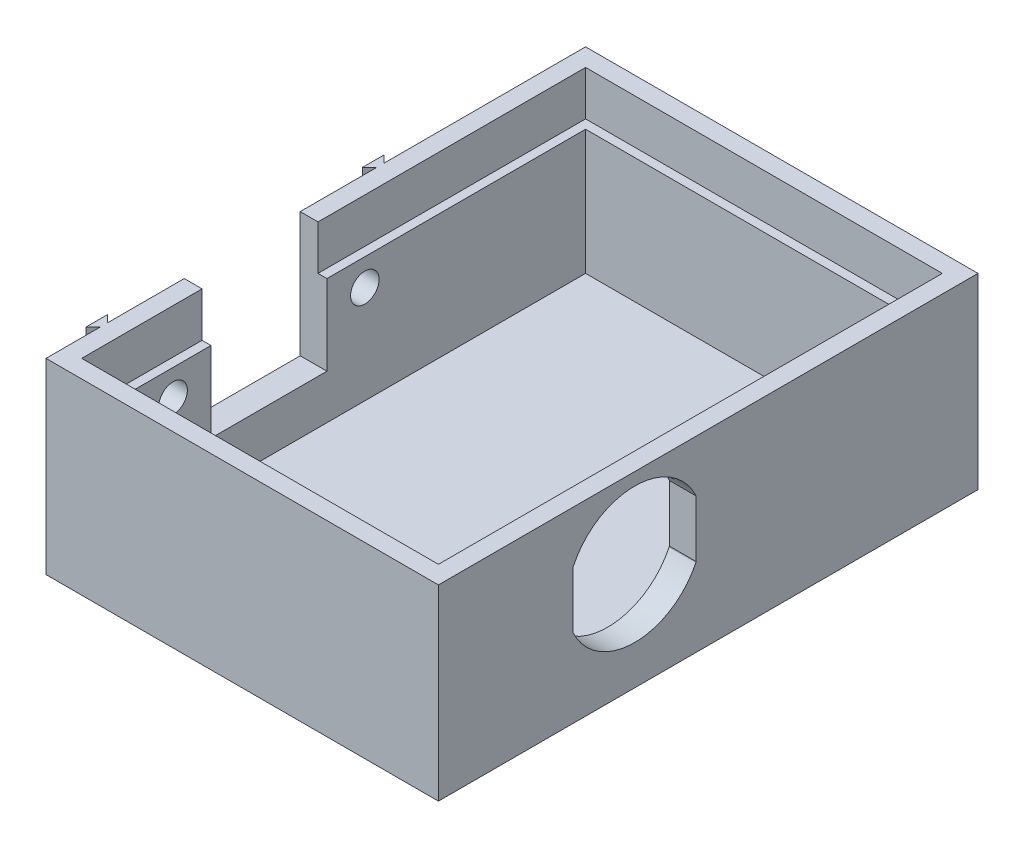
from build123d import *

# Parameters (mm, degrees)
CROQUIS3_W              = 44
CROQUIS3_H              = 60.5
SALIENTE_EXTRUIR1_DEPTH = 2
SALIENTE_EXTRUIR2_DEPTH = 19
CROQUIS5_W              = 3
CROQUIS5_H              = 13
SALIENTE_EXTRUIR3_DEPTH = 5
CROQUIS6_W              = 40
CROQUIS6_H              = 56.5
CROQUIS6_W_2            = 38
CROQUIS6_H_2            = 54.5
CORTAR_EXTRUIR1_DEPTH   = 5
SALIENTE_EXTRUIR4_DEPTH = 15
REDONDEO1_R             = 2
CORTAR_EXTRUIR4_DEPTH   = 10
CROQUIS9_R              = 1.6
CORTAR_EXTRUIR5_DEPTH   = 10


with BuildPart() as part:
    # Croquis3 → Saliente-Extruir1 (new body)
    with BuildSketch(Plane(origin=(0, 0, 0), x_dir=(1, 0, 0), z_dir=(0, 1, 0))):
        with Locations((0, 16.480436564)):
            Rectangle(CROQUIS3_W, CROQUIS3_H)
    extrude(amount=SALIENTE_EXTRUIR1_DEPTH)

    # Croquis4 → Saliente-Extruir2 (add)
    with BuildSketch(Plane(origin=(0, 2, 0), x_dir=(1, 0, 0), z_dir=(0, 1, 0))):
        Polygon((-22, -13.769563436), (22, -13.769563436), (22, 46.730436564), (-22, 46.730436564), (-22, 14.730436564), (-19, 14.730436564), (-19, 43.730436564), (19, 43.730436564), (19, -10.769563436), (-19, -10.769563436), (-19, 1.730436564), (-22, 1.730436564), align=None)
    extrude(amount=SALIENTE_EXTRUIR2_DEPTH)

    # Croquis5 → Saliente-Extruir3 (add)
    with BuildSketch(Plane(origin=(0, 2, 0), x_dir=(1, 0, 0), z_dir=(0, 1, 0))):
        with Locations((-20.5, 8.230436564)):
            Rectangle(CROQUIS5_W, CROQUIS5_H)
    extrude(amount=SALIENTE_EXTRUIR3_DEPTH)

    # Croquis6 → Cortar-Extruir1 (cut)
    with BuildSketch(Plane(origin=(0, 21, 0), x_dir=(1, 0, 0), z_dir=(0, 1, 0))):
        with Locations((0, 16.480436564)):
            Rectangle(CROQUIS6_W, CROQUIS6_H)
        with Locations((0, 16.480436564)):
            Rectangle(CROQUIS6_W_2, CROQUIS6_H_2, mode=Mode.SUBTRACT)
    extrude(amount=-CORTAR_EXTRUIR1_DEPTH, mode=Mode.SUBTRACT)

    # Croquis7 → Saliente-Extruir4 (add)
    with BuildSketch(Plane(origin=(0, 21, 0), x_dir=(1, 0, 0), z_dir=(0, 1, 0))):
        Polygon((-22, -7.269563436), (-22, -6.869563436), (-22.8, -6.069563436), (-22.8, -8.469563436), (-22, -7.669563436), align=None)
        Polygon((-22, 24.130436564), (-22, 23.730436564), (-22, 23.330436564), (-22.8, 22.530436564), (-22.8, 24.930436564), align=None)
    extrude(amount=-SALIENTE_EXTRUIR4_DEPTH)

    # Redondeo1
    # the kernel refuses this fillet: 2 mm, written as the material it adds along each edge
    with BuildSketch(Plane(origin=(-22, 6, 11.669563436), x_dir=(0, -1, 0), z_dir=(0, 0, -1))) as redondeo1_piece_1_section:
        with BuildLine():
            CenterArc((1.6, 2), REDONDEO1_R, 216.869897646, 53.130102354)
            Line((0, 0.8), (-0.032, 0.776))
            ThreePointArc((-0.032, 0.776), (-0.04, 0.4), (-0.04, 0))
            Line((-0.04, 0), (0, -0.04))
            Line((0, -0.04), (1.6, -0.04))
            Line((1.6, -0.04), (1.6, 0))
        make_face()
    redondeo1_piece_1 = extrude(amount=8.8, mode=Mode.PRIVATE)
    redondeo1_piece_1 = split(redondeo1_piece_1, bisect_by=Plane(origin=(-21.934112323, 5.657693128, 7.603675758), z_dir=(-0.7071067811865467, 0, -0.7071067811865483)), keep=Keep.TOP, mode=Mode.PRIVATE)
    redondeo1_piece_1 = split(redondeo1_piece_1, bisect_by=Plane(origin=(-21.934112323, 5.657693128, 6.935451113), z_dir=(-0.7071067811865467, 0, 0.7071067811865483)), keep=Keep.TOP, mode=Mode.PRIVATE)
    add(redondeo1_piece_1)
    with BuildSketch(Plane(origin=(-22, 6, -19.330436564), x_dir=(0, -1, 0), z_dir=(0, 0, -1))) as redondeo1_piece_2_section:
        with BuildLine():
            CenterArc((1.6, 2), REDONDEO1_R, 216.869897646, 53.130102354)
            Line((0, 0.8), (-0.032, 0.776))
            ThreePointArc((-0.032, 0.776), (-0.04, 0.4), (-0.04, 0))
            Line((-0.04, 0), (0, -0.04))
            Line((0, -0.04), (1.6, -0.04))
            Line((1.6, -0.04), (1.6, 0))
        make_face()
    redondeo1_piece_2 = extrude(amount=8.8, mode=Mode.PRIVATE)
    redondeo1_piece_2 = split(redondeo1_piece_2, bisect_by=Plane(origin=(-21.934112323, 5.657693128, -23.396324242), z_dir=(-0.707106781186546, 0, -0.7071067811865491)), keep=Keep.TOP, mode=Mode.PRIVATE)
    redondeo1_piece_2 = split(redondeo1_piece_2, bisect_by=Plane(origin=(-21.934112323, 5.657693128, -24.064548887), z_dir=(-0.7071067811865476, 0, 0.7071067811865476)), keep=Keep.TOP, mode=Mode.PRIVATE)
    add(redondeo1_piece_2)

    # Croquis8 → Cortar-Extruir4 (cut)
    with BuildSketch(Plane(origin=(22, 0, 0), x_dir=(0, 0, -1), z_dir=(1, 0, 0))):
        with BuildLine():
            Line((15.097928983, 8.744612484), (15.130436564, 8.814093536))
            Line((15.130436564, 8.814093536), (15.130436564, 15.185906464))
            ThreePointArc((15.130436564, 15.185906464), (8.230436564, 19.6), (1.330436564, 15.185906464))
            Line((1.330436564, 15.185906464), (1.330436564, 8.814093536))
            ThreePointArc((1.330436564, 8.814093536), (8.192081775, 4.400096783), (15.097928983, 8.744612484))
        make_face()
    extrude(amount=-CORTAR_EXTRUIR4_DEPTH, mode=Mode.SUBTRACT)

    # Croquis9 → Cortar-Extruir5 (cut)
    with BuildSketch(Plane.ZY.offset(22)):
        with Locations((-18.980436564, 13)):
            Circle(CROQUIS9_R)
        with Locations((2.519563436, 13)):
            Circle(CROQUIS9_R)
    extrude(amount=-CORTAR_EXTRUIR5_DEPTH, mode=Mode.SUBTRACT)


solid = part.part
